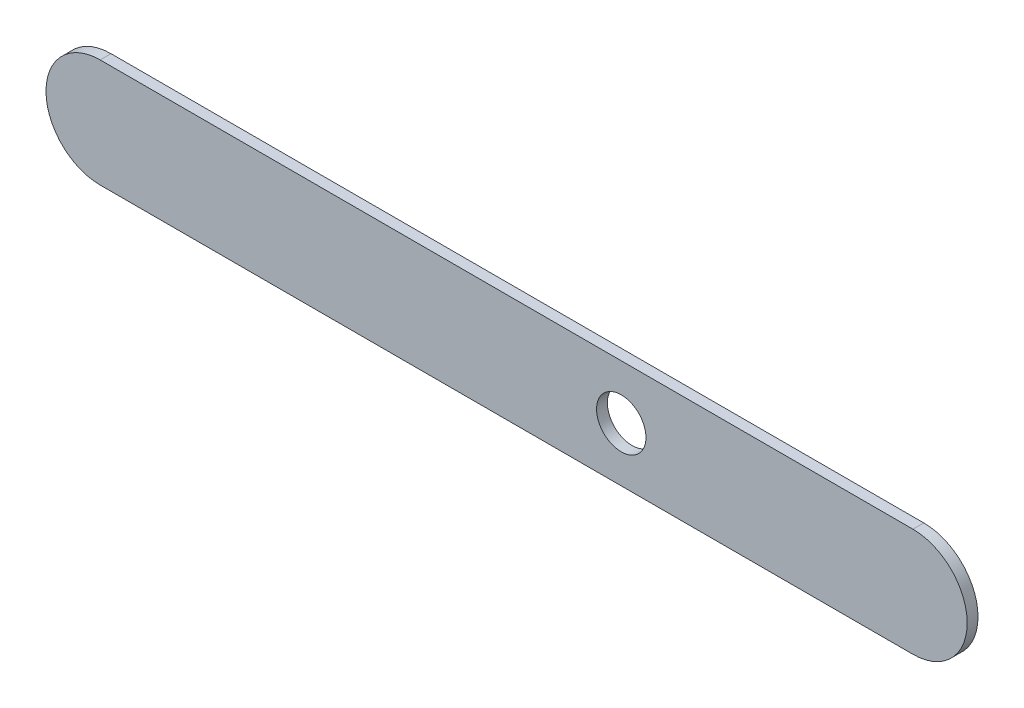
from build123d import *

# Parameters (mm, degrees)
SKETCH1_R           = 4.558097962
BOSS_EXTRUDE1_DEPTH = 1


with BuildPart() as part:
    # Sketch1 → Boss-Extrude1 (new, symmetric)
    with BuildSketch(Plane.XY):
        with BuildLine():
            Line((0, 10), (150, 10))
            ThreePointArc((150, 10), (160, 0), (150, -10))
            Line((150, -10), (0, -10))
            ThreePointArc((0, -10), (-10, 0), (0, 10))
        make_face()
        with Locations((96.159048976, 0)):
            Circle(SKETCH1_R, mode=Mode.SUBTRACT)
    extrude(amount=BOSS_EXTRUDE1_DEPTH, both=True)


solid = part.part
